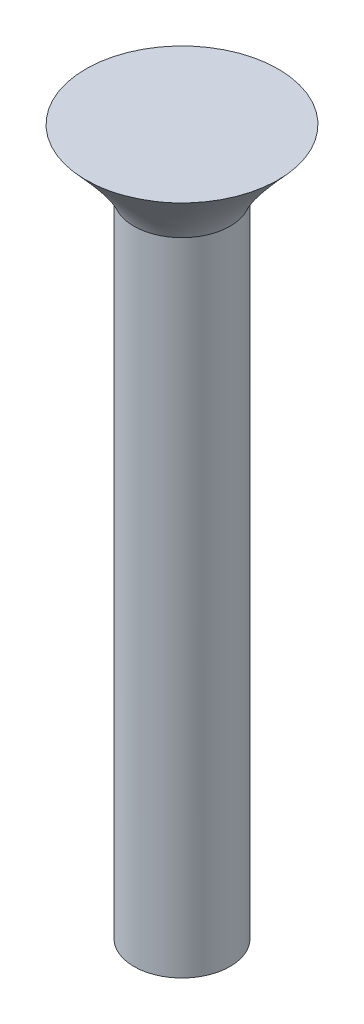
from build123d import *

# Parameters (mm, degrees)
SKETCH1_R           = 1.5
BOSS_EXTRUDE1_DEPTH = 20


with BuildPart() as part:
    # Sketch1 → Boss-Extrude1 (new body)
    with BuildSketch(Plane(origin=(0, 0, 0), x_dir=(1, 0, 0), z_dir=(0, 1, 0))):
        with Locations(Location((0, 0, 0), (0, 0, 270))):
            Circle(SKETCH1_R)
    extrude(amount=BOSS_EXTRUDE1_DEPTH)

    # Loft1: read off the stored shape, not the designer's step
    # Loft1: loft between two sections, ruled curve by curve
    loft1_from = [
        Edge.make_bspline([(-1.367104915, 20, -0.617271538), (-2.601647991, 20, 2.116938292), (0.132561839, 20, 3.351481368), (1.367104915, 20, 0.617271538), (2.601647991, 20, -2.116938292), (-0.132561839, 20, -3.351481368), (-1.367104915, 20, -0.617271538)], [0, 0, 0, 0, 0.5, 0.5, 0.5, 1, 1, 1, 1], 3, [1, 0.333333333, 0.333333333, 1, 0.333333333, 0.333333333, 1]),
    ]
    loft1_to = [
        Edge.make_bspline([(-1.351884798, 22.000000064, -2.678135077), (-6.708154953, 22.000000064, 0.02563452), (-4.004385356, 22.000000064, 5.381904674), (1.351884798, 22.000000064, 2.678135077), (6.708154953, 22.000000064, -0.02563452), (4.004385356, 22.000000064, -5.381904674), (-1.351884798, 22.000000064, -2.678135077)], [0, 0, 0, 0, 0.5, 0.5, 0.5, 1, 1, 1, 1], 3, [1, 0.333333333, 0.333333333, 1, 0.333333333, 0.333333333, 1]),
    ]
    loft1 = Solid(Shell([*[Face.make_surface_from_curves(loft1_from[k], loft1_to[k]) for k in range(1)], Face(Wire(loft1_from)), Face(Wire(loft1_to))]))
    add(loft1)


solid = part.part
